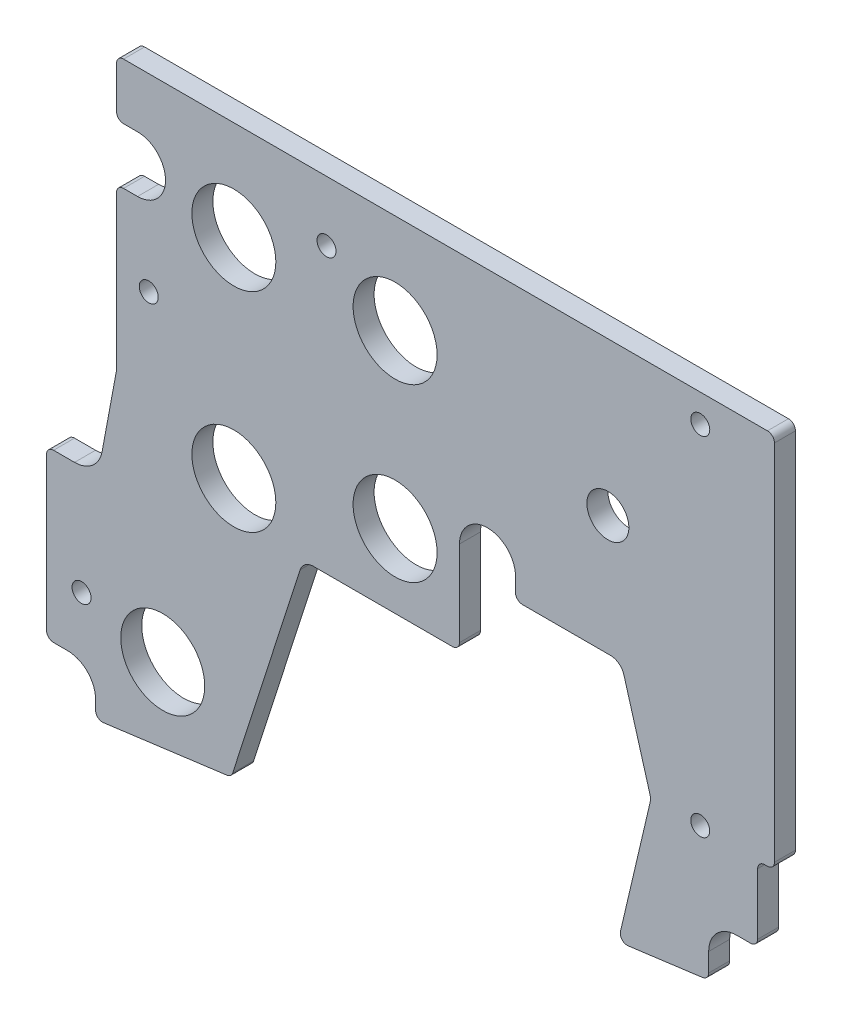
from build123d import *

# Parameters (mm, degrees)
BOSS_EXTRUDE1_DEPTH   = 4.7625
F_6_CLEARANCE_HOLE1_D = 4.3053
SKETCH5_R             = 9.525
SKETCH5_R_2           = 4.7625
CUT_EXTRUDE1_DEPTH    = 215.066671615


with BuildPart() as part:
    # Sketch1 → Boss-Extrude1 (new body)
    with BuildSketch(Plane.XY):
        with BuildLine():
            Line((-1.58748798, -85.534500226), (-1.587499702, -3.175000338))
            ThreePointArc((-1.587499702, -3.175000338), (-2.052467807, -2.052468316), (-3.174999928, -1.587500451))
            Line((-3.174999928, -1.587500451), (-149.225000608, -1.587521198))
            ThreePointArc((-149.225000608, -1.587521198), (-150.34753241, -2.052489195), (-150.812500382, -3.175021007))
            Line((-150.812500382, -3.175021007), (-150.812501529, -12.700020556))
            ThreePointArc((-150.812501529, -12.700020556), (-150.347533612, -13.822552695), (-149.225001529, -14.287520747))
            Line((-149.225001529, -14.287520747), (-146.049997068, -14.287520747))
            ThreePointArc((-146.049997068, -14.287520747), (-139.699997068, -20.637520747), (-146.049997068, -26.987520747))
            Line((-146.049997068, -26.987520747), (-149.225013631, -26.987520747))
            ThreePointArc((-149.225013631, -26.987520747), (-150.347545646, -27.452488732), (-150.812513631, -28.575020747))
            Line((-150.812513631, -28.575020747), (-150.812513631, -63.3538504))
            ThreePointArc((-150.812513631, -63.3538504), (-150.819200601, -63.499405937), (-150.839205177, -63.643735238))
            Line((-150.839205177, -63.643735238), (-154.094231629, -81.169566712))
            ThreePointArc((-154.094231629, -81.169566712), (-156.277952028, -84.892947063), (-160.337486649, -86.360044427))
            Line((-160.337486649, -86.360044427), (-165.099987777, -86.360045103))
            ThreePointArc((-165.099987777, -86.360045103), (-166.222519646, -86.825013168), (-166.687487552, -87.947545103))
            Line((-166.687487552, -87.947545103), (-166.687487552, -122.545535149))
            ThreePointArc((-166.687487552, -122.545535149), (-166.222519567, -123.668067164), (-165.099987552, -124.133035149))
            Line((-165.099987552, -124.133035149), (-161.924987552, -124.133035149))
            ThreePointArc((-161.924987552, -124.133035149), (-157.434859491, -125.992907088), (-155.574987552, -130.483035149))
            Line((-155.574987552, -130.483035149), (-155.574987552, -132.640440399))
            ThreePointArc((-155.574987552, -132.640440399), (-155.034199033, -133.833986093), (-153.780277221, -134.214359116))
            Line((-153.780277221, -134.214359116), (-125.771097932, -130.526880708))
            ThreePointArc((-125.771097932, -130.526880708), (-124.961326394, -130.171938663), (-124.467007026, -129.438888758))
            Line((-124.467007026, -129.438888758), (-109.180488679, -81.895646464))
            ThreePointArc((-109.180488679, -81.895646464), (-108.028045294, -80.301738907), (-106.157886207, -79.6925))
            Line((-106.157886207, -79.6925), (-74.612491751, -79.6925))
            ThreePointArc((-74.612491751, -79.6925), (-73.489959736, -79.227532015), (-73.024991751, -78.105))
            Line((-73.024991751, -78.105), (-73.024991751, -58.7375))
            ThreePointArc((-73.024991751, -58.7375), (-66.674991751, -52.3875), (-60.324991751, -58.7375))
            Line((-60.324991751, -58.7375), (-60.324991751, -61.9125))
            ThreePointArc((-60.324991751, -61.9125), (-59.860023766, -63.035032015), (-58.737491751, -63.5))
            Line((-58.737491751, -63.5), (-38.786604302, -63.5))
            ThreePointArc((-38.786604302, -63.5), (-36.87752741, -64.138062787), (-35.735764486, -65.795795009))
            Line((-35.735764486, -65.795795009), (-29.83134609, -86.284116742))
            ThreePointArc((-29.83134609, -86.284116742), (-29.708193003, -87.083358908), (-29.790944576, -87.887788459))
            Line((-29.790944576, -87.887788459), (-36.522349245, -116.610151533))
            ThreePointArc((-36.522349245, -116.610151533), (-36.153591729, -118.037818788), (-34.769518371, -118.546303629))
            Line((-34.769518371, -118.546303629), (-17.8902735, -116.324110206))
            ThreePointArc((-17.8902735, -116.324110206), (-16.903937981, -115.796902916), (-16.509983709, -114.750191247))
            Line((-16.509983709, -114.750191247), (-16.509984311, -110.516938696))
            ThreePointArc((-16.509984311, -110.516938696), (-14.655116284, -106.017688645), (-10.160000902, -104.152822935))
            Line((-10.160000902, -104.152822935), (-6.9849852, -104.152822484))
            ThreePointArc((-6.9849852, -104.152822484), (-5.862453251, -103.687854339), (-5.397485425, -102.565322258))
            Line((-5.397485425, -102.565322258), (-5.397487394, -88.709500767))
            ThreePointArc((-5.397487394, -88.709500767), (-4.932519529, -87.586968646), (-3.809987507, -87.122000541))
            Line((-3.809987507, -87.122000541), (-3.17498789, -87.122000474))
            ThreePointArc((-3.17498789, -87.122000474), (-2.052455852, -86.657032363), (-1.58748798, -85.534500226))
        make_face()
    extrude(amount=BOSS_EXTRUDE1_DEPTH)

    # #6 Clearance Hole1 (through all)
    with Locations(Plane.XY.offset(4.7625)):
        with Locations((-103.187497835, -15.240014659), (-18.414998872, -7.937503157), (-143.510001128, -44.450020387), (-158.750001128, -111.125021649), (-18.414987678, -86.741003157)):
            Hole(F_6_CLEARANCE_HOLE1_D / 2)

    # Sketch5 → Cut-Extrude1 (cut, through all)
    with BuildSketch(Plane.XY.offset(4.7625)):
        with Locations((-124.205996572, -24.130021649)):
            Circle(SKETCH5_R)
        with Locations((-87.63, -24.130021649)):
            Circle(SKETCH5_R)
        with Locations((-87.63, -62.992021649)):
            Circle(SKETCH5_R)
        with Locations((-124.205996572, -71.437521424)):
            Circle(SKETCH5_R)
        with Locations((-140.334987552, -115.57)):
            Circle(SKETCH5_R)
        with Locations((-39.36999484, -36.322003157)):
            Circle(SKETCH5_R_2)
    extrude(amount=-CUT_EXTRUDE1_DEPTH, mode=Mode.SUBTRACT)


solid = part.part
